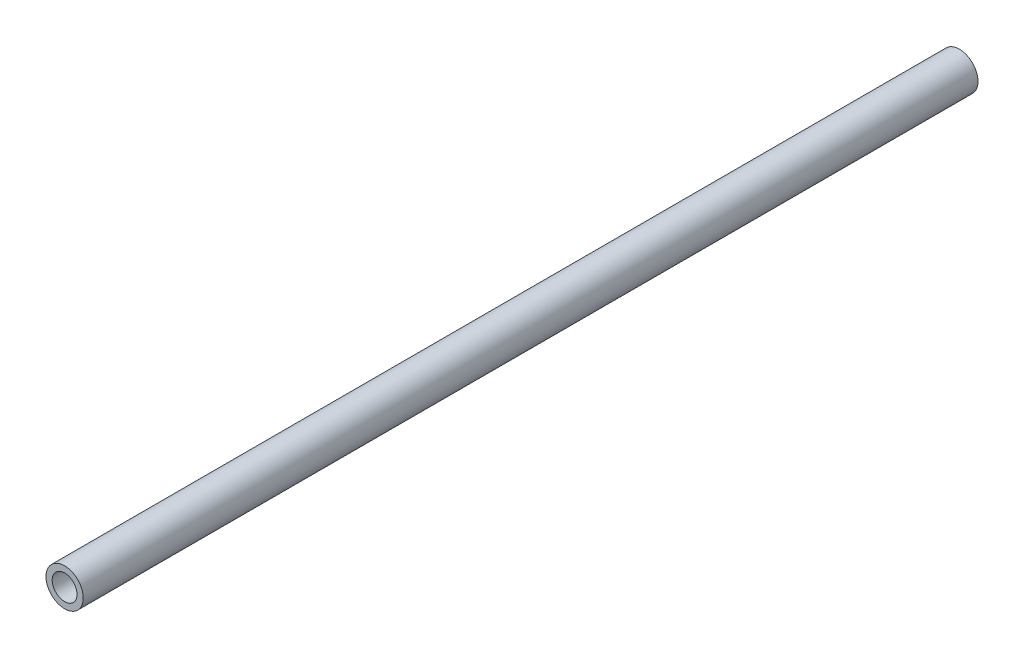
from build123d import *

# Parameters (mm, degrees)
SKETCH1_R           = 9.525
SKETCH1_R_2         = 6.35
BOSS_EXTRUDE1_DEPTH = 457.2


with BuildPart() as part:
    # Sketch1 → Boss-Extrude1 (new body)
    with BuildSketch(Plane.XY):
        Circle(SKETCH1_R)
        Circle(SKETCH1_R_2, mode=Mode.SUBTRACT)
    extrude(amount=BOSS_EXTRUDE1_DEPTH)


solid = part.part
